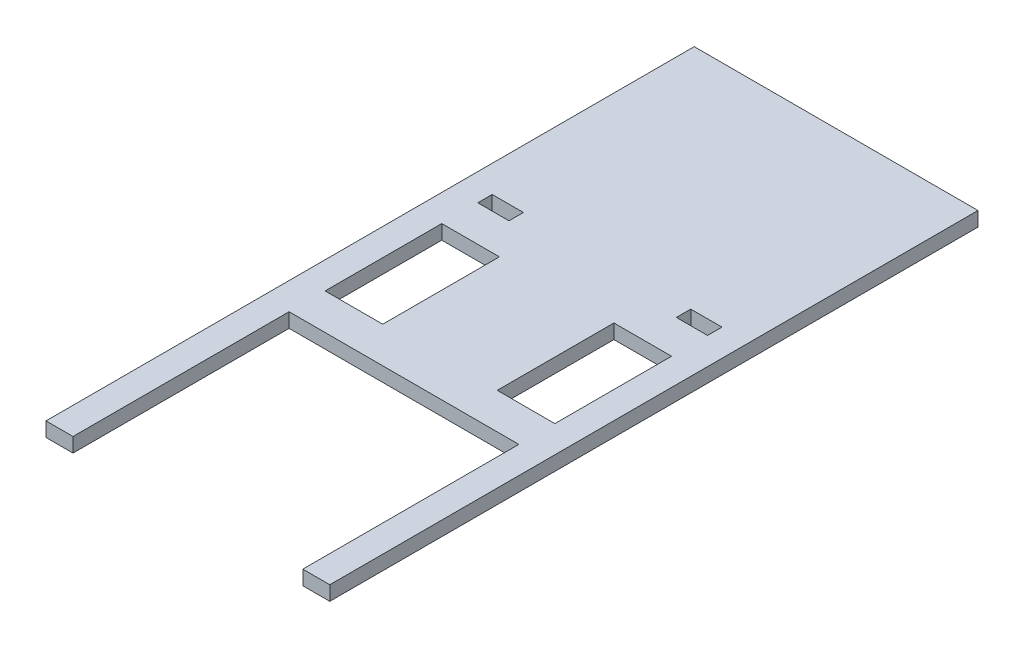
from build123d import *

# Parameters (mm, degrees)
SKETCH1_W           = 100.076
SKETCH1_H           = 228.6
BOSS_EXTRUDE1_DEPTH = 5.08
SKETCH2_W           = 81.026
SKETCH2_H           = 76.2
CUT_EXTRUDE1_DEPTH  = 5.08
SKETCH3_W           = 20.32
SKETCH3_H           = 41.148
SKETCH3_W_2         = 10.9982
SKETCH3_H_2         = 5.08
CUT_EXTRUDE2_DEPTH  = 5.08


with BuildPart() as part:
    # Sketch1 → Boss-Extrude1 (new body)
    with BuildSketch(Plane(origin=(0, 0, 0), x_dir=(1, 0, 0), z_dir=(0, 1, 0))):
        Rectangle(SKETCH1_W, SKETCH1_H)
    extrude(amount=BOSS_EXTRUDE1_DEPTH)

    # Sketch2 → Cut-Extrude1 (cut)
    with BuildSketch(Plane(origin=(0, 5.08, 0), x_dir=(1, 0, 0), z_dir=(0, 1, 0))):
        with Locations((0, -76.2)):
            Rectangle(SKETCH2_W, SKETCH2_H)
    extrude(amount=-CUT_EXTRUDE1_DEPTH, mode=Mode.SUBTRACT)

    # Sketch3 → Cut-Extrude2 (cut)
    with BuildSketch(Plane(origin=(0, 5.08, 0), x_dir=(1, 0, 0), z_dir=(0, 1, 0))):
        with Locations((-30.353, -4.826)):
            Rectangle(SKETCH3_W, SKETCH3_H)
        with Locations((-35.0139, 30.988)):
            Rectangle(SKETCH3_W_2, SKETCH3_H_2)
        with Locations((30.353, -4.826)):
            Rectangle(SKETCH3_W, SKETCH3_H)
        with Locations((35.0139, 30.988)):
            Rectangle(SKETCH3_W_2, SKETCH3_H_2)
    extrude(amount=-CUT_EXTRUDE2_DEPTH, mode=Mode.SUBTRACT)


solid = part.part
